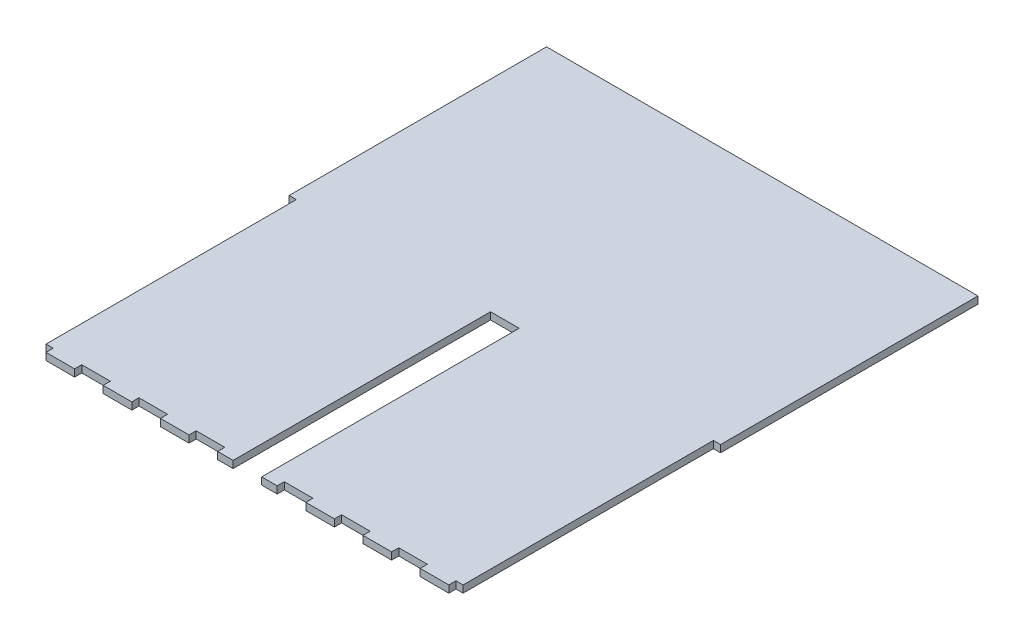
from build123d import *

# Parameters (mm, degrees)
BOSS_EXTRUDE1_DEPTH = 3


with BuildPart() as part:
    # Sketch1 → Boss-Extrude1 (new body)
    with BuildSketch(Plane(origin=(0, 0, 0), x_dir=(1, 0, 0), z_dir=(0, 1, 0))):
        Polygon((-90.5, 0), (-87.5, 0), (-87.5, -105), (-84.5, -105), (-84.5, -108), (-72.5, -108), (-72.5, -105), (-60.5, -105), (-60.5, -108), (-48.5, -108), (-48.5, -105), (-36.5, -105), (-36.5, -108), (-24.5, -108), (-24.5, -105), (-12.5, -105), (-12.5, -108), (-6, -108), (-6, 0), (6, 0), (6, -108), (12.5, -108), (12.5, -105), (24.5, -105), (24.5, -108), (36.5, -108), (36.5, -105), (48.5, -105), (48.5, -108), (60.5, -108), (60.5, -105), (72.5, -105), (72.5, -108), (84.5, -108), (84.5, -105), (87.5, -105), (87.5, 0), (90.5, 0), (90.5, 108), (-90.5, 108), align=None)
    extrude(amount=BOSS_EXTRUDE1_DEPTH)


solid = part.part
